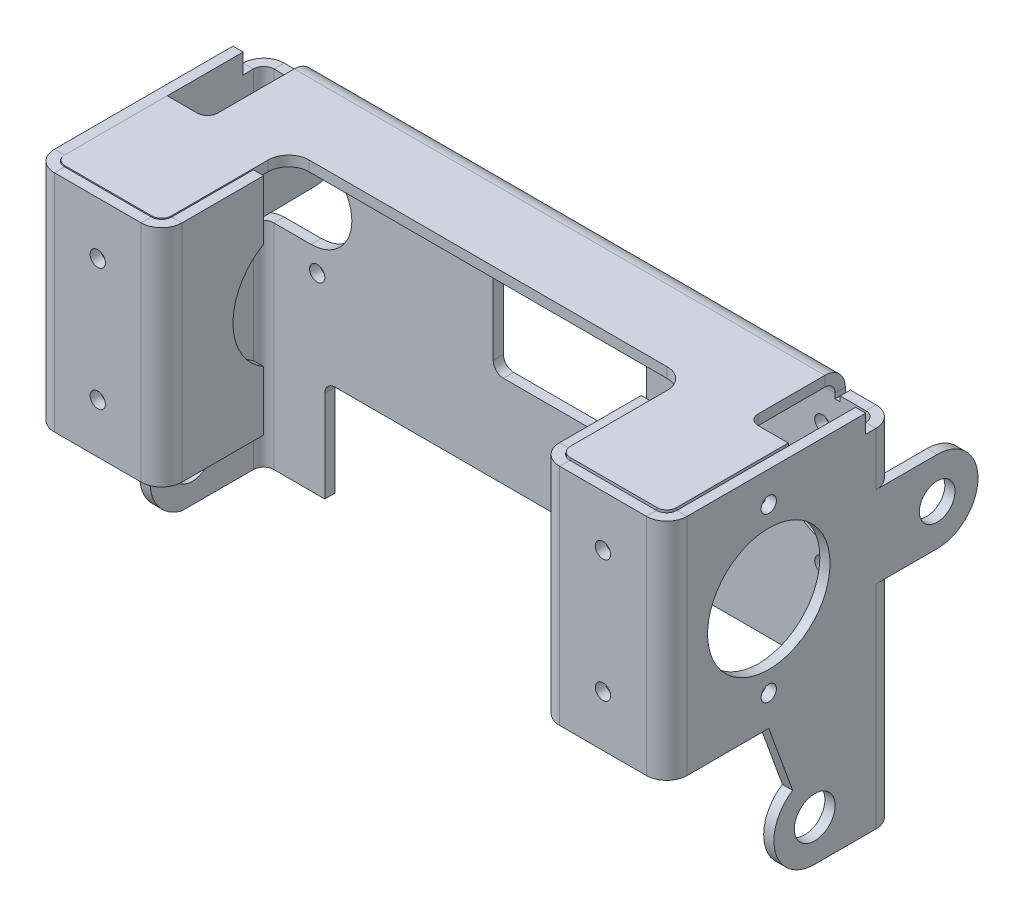
from build123d import *

# Parameters (mm, degrees)
BASE_FLANGE1_DEPTH           = 2
EDGE_FLANGE1_STRIP_W         = 12
EDGE_FLANGE1_STRIP_H         = 2
EDGE_FLANGE1_STRIP_CUT_DEPTH = 68
EDGE_FLANGE1_DEPTH           = 68
EDGE_FLANGE1_PROFILE_R       = 4
EDGE_FLANGE1_FLAT_DEPTH      = 2
EDGE_FLANGE2_STRIP_W         = 12
EDGE_FLANGE2_STRIP_H         = 2
EDGE_FLANGE2_STRIP_CUT_DEPTH = 44
EDGE_FLANGE2_DEPTH           = 44
EDGE_FLANGE3_STRIP_W         = 12
EDGE_FLANGE3_STRIP_H         = 2
EDGE_FLANGE3_STRIP_CUT_DEPTH = 44
EDGE_FLANGE3_DEPTH           = 44
SKETCH24_R                   = 12
SKETCH24_R_2                 = 1.5
CUT_EXTRUDE1_DEPTH           = 10
CUT_EXTRUDE2_START           = -10
SKETCH25_R                   = 12
CUT_EXTRUDE2_DEPTH           = 10
SKETCH26_R                   = 1.5
CUT_EXTRUDE3_DEPTH           = 139.956827828
UNFOLD1_DEPTH                = 71.573994365
UNFOLD1_START                = 27.573994365
UNFOLD1_2_DEPTH              = 4.4999999
UNFOLD1_START_2              = 67.073994465
UNFOLD1_3_DEPTH              = 4.4999999
UNFOLD1_4_DEPTH              = 68
UNFOLD1_START_3              = 35.073994465
UNFOLD1_5_DEPTH              = 0.9999998
UNFOLD1_START_4              = 63.073994465
UNFOLD1_6_DEPTH              = 0.9999998
UNFOLD1_7_DEPTH              = 67.073994465
UNFOLD1_START_5              = -2
UNFOLD1_8_OUTLINE_R          = 12
UNFOLD1_8_OUTLINE_R_2        = 4
UNFOLD1_8_DEPTH              = 25
UNFOLD1_9_DEPTH              = 2
UNFOLD1_START_6              = 149.71238898
UNFOLD1_10_OUTLINE_R         = 1.5
UNFOLD1_10_DEPTH             = 2
CUT_EXTRUDE4_DEPTH           = 170.498227041
CUT_EXTRUDE4_DEPTH_BACK      = 170.498227041
FOLD1_DEPTH                  = 71.573994365
FOLD1_2_DEPTH                = 71.573994365
FOLD1_3_DEPTH                = 41.573994365
FOLD1_START                  = 41.573994365
FOLD1_4_OUTLINE_W            = 2
FOLD1_4_OUTLINE_H            = 2
FOLD1_4_DEPTH                = 26.426005635
FOLD1_START_2                = 57.573994365
FOLD1_5_DEPTH                = 10.426005635
FOLD1_START_3                = 85
FOLD1_6_OUTLINE_R            = 12
FOLD1_6_OUTLINE_R_2          = 4
FOLD1_6_DEPTH                = 25
FOLD1_START_4                = 108
FOLD1_7_DEPTH                = 2
FOLD1_START_5                = 41
FOLD1_8_OUTLINE_R            = 1.5
FOLD1_8_DEPTH                = 2
TAB1_DEPTH                   = 2
CUT_EXTRUDE5_DEPTH           = 150.696359341
CUT_EXTRUDE5_DEPTH_BACK      = 150.696359341
SKETCH35_R                   = 3.5
EDGE_FLANGE4_STRIP_W         = 12
EDGE_FLANGE4_STRIP_H         = 2
EDGE_FLANGE4_STRIP_CUT_DEPTH = 68
EDGE_FLANGE4_DEPTH           = 68
EDGE_FLANGE4_FLAT_DEPTH      = 2
EDGE_FLANGE5_STRIP_W         = 12
EDGE_FLANGE5_STRIP_H         = 2
EDGE_FLANGE5_STRIP_CUT_DEPTH = 71.872497443
EDGE_FLANGE5_DEPTH           = 71.872497443
EDGE_FLANGE6_STRIP_W         = 12
EDGE_FLANGE6_STRIP_H         = 2
EDGE_FLANGE6_STRIP_CUT_DEPTH = 71.872497443
EDGE_FLANGE6_DEPTH           = 71.872497443
CUT_EXTRUDE7_DEPTH           = 150.696359341
CUT_EXTRUDE7_DEPTH_BACK      = 30
SKETCH47_R                   = 4
SKETCH47_R_2                 = 12
SKETCH47_R_3                 = 1.5
SKETCH53_W                   = 4
SKETCH53_H                   = 27.872497443
CUT_EXTRUDE10_DEPTH          = 30
UNFOLD5_DEPTH                = 43
UNFOLD5_START                = -2
UNFOLD5_2_OUTLINE_R          = 4
UNFOLD5_2_OUTLINE_R_2        = 1.5
UNFOLD5_2_DEPTH              = 1.81124
UNFOLD5_START_2              = 19
UNFOLD5_3_DEPTH              = 4
UNFOLD5_START_3              = -1.78876
UNFOLD5_4_DEPTH              = 3.78876
UNFOLD5_START_4              = 1.61096
UNFOLD5_5_OUTLINE_W          = 2
UNFOLD5_5_OUTLINE_H          = 44
UNFOLD5_5_DEPTH              = 18.873595853
UNFOLD5_6_OUTLINE_R          = 4
UNFOLD5_6_OUTLINE_R_2        = 1.5
UNFOLD5_6_DEPTH              = 1.78876
UNFOLD5_7_DEPTH              = 71.872497443
UNFOLD5_START_5              = 68
UNFOLD5_8_OUTLINE_W          = 8
UNFOLD5_8_OUTLINE_H          = 1.81124
UNFOLD5_8_DEPTH              = 3.872497443
UNFOLD5_9_DEPTH              = 27.872497443
CUT_EXTRUDE11_DEPTH          = 30
FOLD4_DEPTH                  = 71.872497443
FOLD4_2_DEPTH                = 71.872497443
FOLD4_3_DEPTH                = 41.872497443
FOLD4_START                  = 41.872497443
FOLD4_4_OUTLINE_W            = 2
FOLD4_4_OUTLINE_H            = 2
FOLD4_4_DEPTH                = 26.127502557
FOLD4_START_2                = 57.872497443
FOLD4_5_DEPTH                = 10.127502557
FOLD4_START_3                = -14
FOLD4_6_OUTLINE_R            = 4
FOLD4_6_OUTLINE_R_2          = 1.5
FOLD4_6_DEPTH                = 25
TAB5_START                   = -2
SKETCH66_R                   = 3.5
TAB5_DEPTH                   = 2
EDGE_FLANGE7_START           = -4
EDGE_FLANGE7_DEPTH           = 104
EDGE_FLANGE7_START_2         = 89
EDGE_FLANGE7_2_OUTLINE_W     = 2
EDGE_FLANGE7_2_OUTLINE_H     = 23.823099538
EDGE_FLANGE7_2_DEPTH         = 17
EDGE_FLANGE7_START_3         = -10
EDGE_FLANGE7_3_OUTLINE_W     = 2
EDGE_FLANGE7_3_OUTLINE_H     = 21.9
EDGE_FLANGE7_3_DEPTH         = 17
EDGE_FLANGE7_4_OUTLINE_W     = 2
EDGE_FLANGE7_4_OUTLINE_H     = 3
EDGE_FLANGE7_4_DEPTH         = 12.9
EDGE_FLANGE7_START_4         = 87.1
EDGE_FLANGE7_5_OUTLINE_W     = 2
EDGE_FLANGE7_5_OUTLINE_H     = 3
EDGE_FLANGE7_5_DEPTH         = 12.9
EDGE_FLANGE7_START_5         = 102
EDGE_FLANGE7_6_OUTLINE_W     = 2
EDGE_FLANGE7_6_OUTLINE_H     = 1.923099538
EDGE_FLANGE7_6_DEPTH         = 5.9
EDGE_FLANGE7_START_6         = 70
EDGE_FLANGE7_7_DEPTH         = 2
EDGE_FLANGE7_8_DEPTH         = 104
EDGE_FLANGE7_START_7         = -5
EDGE_FLANGE7_9_OUTLINE_W     = 1
EDGE_FLANGE7_9_OUTLINE_H     = 2
EDGE_FLANGE7_9_DEPTH         = 1
EDGE_FLANGE7_START_8         = 100
EDGE_FLANGE7_10_OUTLINE_W    = 1
EDGE_FLANGE7_10_OUTLINE_H    = 2
EDGE_FLANGE7_10_DEPTH        = 1
EDGE_FLANGE7_START_9         = 71.57752
EDGE_FLANGE7_11_OUTLINE_W    = 104
EDGE_FLANGE7_11_OUTLINE_H    = 2
EDGE_FLANGE7_11_DEPTH        = 1.42248


with BuildPart() as part:
    # Base-Flange1: sheet metal written as solids
    # Sketch6 → Base-Flange1 (new body)
    with BuildSketch(Plane.XY):
        with BuildLine():
            Line((0, 0), (0, 18))
            ThreePointArc((0, 18), (0.585786438, 19.414213562), (2, 20))
            Line((2, 20), (94, 20))
            ThreePointArc((94, 20), (95.414213562, 19.414213562), (96, 18))
            Line((96, 18), (96, 0))
            Line((96, 0), (110, 0))
            Line((110, 0), (110, 68))
            Line((110, 68), (100, 68))
            Line((100, 68), (100, 72))
            Line((100, 72), (-4, 72))
            Line((-4, 72), (-4, 68))
            Line((-4, 68), (-14, 68))
            Line((-14, 68), (-14, 0))
            Line((-14, 0), (0, 0))
        make_face()
        with BuildLine():
            Line((35, 62), (61, 62))
            ThreePointArc((61, 62), (62.414213562, 61.414213562), (63, 60))
            Line((63, 60), (63, 40))
            ThreePointArc((63, 40), (62.414213562, 38.585786438), (61, 38))
            Line((61, 38), (35, 38))
            ThreePointArc((35, 38), (33.585786438, 38.585786438), (33, 40))
            Line((33, 40), (33, 60))
            ThreePointArc((33, 60), (33.585786438, 61.414213562), (35, 62))
        make_face(mode=Mode.SUBTRACT)
    extrude(amount=-BASE_FLANGE1_DEPTH)

    # Edge-Flange1: sheet metal written as solids
    # Edge-Flange1 strip (on a plane across the edge) → Edge-Flange1 strip cut (cut)
    with BuildSketch(Plane(origin=(110, 0, 0), x_dir=(-1, 0, 0), z_dir=(0, 1, 0))):
        with Locations((-2, -1)):
            Rectangle(EDGE_FLANGE1_STRIP_W, EDGE_FLANGE1_STRIP_H)
    extrude(amount=EDGE_FLANGE1_STRIP_CUT_DEPTH, mode=Mode.SUBTRACT)

    # Edge-Flange1 bend section (on a plane across the edge) → Edge-Flange1 (add)
    with BuildSketch(Plane(origin=(110, 0, 0), x_dir=(-1, 0, 0), z_dir=(0, 1, 0))):
        with BuildLine():
            Line((0, 2), (2, 2))
            ThreePointArc((2, 2), (2.585786438, 0.585786438), (4, 0))
            Line((4, 0), (4, -2))
            ThreePointArc((4, -2), (1.171572875, -0.828427125), (0, 2))
        make_face()
    extrude(amount=EDGE_FLANGE1_DEPTH)

    # Edge-Flange1 profile (on flange) → Edge-Flange1 flat (add)
    with BuildSketch(Plane(origin=(110, 0, 0), x_dir=(0, -1, 0), z_dir=(-1, 0, 0))):
        with BuildLine():
            ThreePointArc((0, 14), (-5.746115462, 21.675936717), (-14.730001122, 18.325168771))
            Line((-14.730001122, 18.325168771), (-27.573994365, 23))
            Line((-27.573994365, 23), (-27.573994365, 43))
            Line((-27.573994365, 43), (-71.573994365, 43))
            Line((-71.573994365, 43), (-71.573994365, 4))
            Line((-71.573994365, 4), (-68, 4))
            Line((-68, 4), (-68, 2))
            Line((-68, 2), (0, 2))
            Line((0, 2), (0, 14))
        make_face()
        with Locations((-8, 14)):
            Circle(EDGE_FLANGE1_PROFILE_R, mode=Mode.SUBTRACT)
    extrude(amount=EDGE_FLANGE1_FLAT_DEPTH)

    # Edge-Flange2: sheet metal written as solids
    # Edge-Flange2 strip (on a plane across the edge) → Edge-Flange2 strip cut (cut)
    with BuildSketch(Plane(origin=(108, 27.573994365, 43), x_dir=(0, 0, -1), z_dir=(0, 1, 0))):
        with Locations((-2, -1)):
            Rectangle(EDGE_FLANGE2_STRIP_W, EDGE_FLANGE2_STRIP_H)
    extrude(amount=EDGE_FLANGE2_STRIP_CUT_DEPTH, mode=Mode.SUBTRACT)

    # Edge-Flange2 section (on a plane across the edge) → Edge-Flange2 (add)
    with BuildSketch(Plane(origin=(108, 27.573994365, 43), x_dir=(0, 0, -1), z_dir=(0, 1, 0))):
        with BuildLine():
            Line((0, 2), (0, 23))
            Line((0, 23), (2, 23))
            Line((2, 23), (2, 2))
            ThreePointArc((2, 2), (2.585786438, 0.585786438), (4, 0))
            Line((4, 0), (4, -2))
            ThreePointArc((4, -2), (1.171572875, -0.828427125), (0, 2))
        make_face()
    extrude(amount=EDGE_FLANGE2_DEPTH)

    # Edge-Flange3: sheet metal written as solids
    # Edge-Flange3 strip (on a plane across the edge) → Edge-Flange3 strip cut (cut)
    with BuildSketch(Plane(origin=(85, 27.573994365, 41), x_dir=(1, 0, 0), z_dir=(0, 1, 0))):
        with Locations((-2, -1)):
            Rectangle(EDGE_FLANGE3_STRIP_W, EDGE_FLANGE3_STRIP_H)
    extrude(amount=EDGE_FLANGE3_STRIP_CUT_DEPTH, mode=Mode.SUBTRACT)

    # Edge-Flange3 section (on a plane across the edge) → Edge-Flange3 (add)
    with BuildSketch(Plane(origin=(85, 27.573994365, 41), x_dir=(1, 0, 0), z_dir=(0, 1, 0))):
        with BuildLine():
            Line((0, 2), (0, 18))
            Line((0, 18), (2, 18))
            Line((2, 18), (2, 2))
            ThreePointArc((2, 2), (2.585786438, 0.585786438), (4, 0))
            Line((4, 0), (4, -2))
            ThreePointArc((4, -2), (1.171572875, -0.828427125), (0, 2))
        make_face()
    extrude(amount=EDGE_FLANGE3_DEPTH)

    # Sketch24 → Cut-Extrude1 (cut)
    with BuildSketch(Plane(origin=(110, 0, 0), x_dir=(0, 0, -1), z_dir=(1, 0, 0))):
        with Locations((-23, 49.573994365)):
            Circle(SKETCH24_R)
        with Locations((-23, 65.573994365)):
            Circle(SKETCH24_R_2)
        with Locations(Location((-23, 33.573994365, 0), (0, 0, 180))):
            Circle(SKETCH24_R_2)
    extrude(amount=-CUT_EXTRUDE1_DEPTH, mode=Mode.SUBTRACT)

    # Sketch25 → Cut-Extrude2 (cut)
    with BuildSketch(Plane.ZY.offset(-85).offset(CUT_EXTRUDE2_START)):
        with Locations(Location((23, 49.573994365, 0), (0, 0, 180))):
            Circle(SKETCH25_R)
    extrude(amount=CUT_EXTRUDE2_DEPTH, mode=Mode.SUBTRACT)

    # Sketch26 → Cut-Extrude3 (cut, symmetric)
    with BuildSketch(Plane.XY.offset(43)):
        with Locations((97.5, 61.573994365)):
            Circle(SKETCH26_R)
        with Locations(Location((97.5, 37.573994365, 0), (0, 0, 180))):
            Circle(SKETCH26_R)
    cut_extrude3 = extrude(amount=CUT_EXTRUDE3_DEPTH, both=True, mode=Mode.SUBTRACT)

    # Unfold1: read off the stored shape, not the designer's step
    # Unfold1 outline → Unfold1 (cut)
    with BuildSketch(Plane(origin=(0, 0, 0), x_dir=(1, 0, 0), z_dir=(0, 1, 0))):
        with BuildLine():
            ThreePointArc((110, -2), (109.863703305, -0.96472382), (109.464101616, 0))
            Line((109.464101616, 0), (106, 0))
            ThreePointArc((106, 0), (107.414213562, -0.585786438), (108, -2))
            Line((108, -2), (108, -39))
            ThreePointArc((108, -39), (107.414213562, -40.414213562), (106, -41))
            Line((106, -41), (89, -41))
            ThreePointArc((89, -41), (87.585786438, -40.414213562), (87, -39))
            Line((87, -39), (87, -23))
            Line((87, -23), (85, -23))
            Line((85, -23), (85, -39))
            ThreePointArc((85, -39), (86.171572875, -41.828427125), (89, -43))
            Line((89, -43), (106, -43))
            ThreePointArc((106, -43), (108.828427125, -41.828427125), (110, -39))
            Line((110, -39), (110, -2))
        make_face()
    extrude(amount=UNFOLD1_DEPTH, mode=Mode.SUBTRACT)

    # Unfold1 2 outline → Unfold1 2 (add)
    with BuildSketch(Plane(origin=(0, 0, 0), x_dir=(1, 0, 0), z_dir=(0, 1, 0)).offset(UNFOLD1_START)):
        with BuildLine():
            Line((147.71238898, -21), (131.71238898, -21))
            Line((131.71238898, -21), (131.71238898, -23))
            Line((131.71238898, -23), (147.71238898, -23))
            ThreePointArc((147.71238898, -23), (150.540816105, -21.828427125), (151.71238898, -19))
            Line((151.71238898, -19), (151.71238898, -2))
            ThreePointArc((151.71238898, -2), (150.540816105, 0.828427125), (147.71238898, 2))
            Line((147.71238898, 2), (106, 2))
            ThreePointArc((106, 2), (108, 1.464101615), (109.464101616, 0))
            Line((109.464101616, 0), (147.71238898, 0))
            ThreePointArc((147.71238898, 0), (149.126602542, -0.585786437), (149.71238898, -2))
            Line((149.71238898, -2), (149.71238898, -19))
            ThreePointArc((149.71238898, -19), (149.126602542, -20.414213563), (147.71238898, -21))
        make_face()
    extrude(amount=UNFOLD1_2_DEPTH)



with BuildPart() as body_2:
    # Unfold1 3 outline → Unfold1 3 (new body)
    with BuildSketch(Plane(origin=(0, 0, 0), x_dir=(1, 0, 0), z_dir=(0, 1, 0)).offset(UNFOLD1_START_2)):
        with BuildLine():
            Line((147.71238898, -21), (131.71238898, -21))
            Line((131.71238898, -21), (131.71238898, -23))
            Line((131.71238898, -23), (147.71238898, -23))
            ThreePointArc((147.71238898, -23), (150.540816105, -21.828427125), (151.71238898, -19))
            Line((151.71238898, -19), (151.71238898, -2))
            ThreePointArc((151.71238898, -2), (150.540816105, 0.828427125), (147.71238898, 2))
            Line((147.71238898, 2), (112.71238898, 2))
            Line((112.71238898, 2), (112.71238898, 0))
            Line((112.71238898, 0), (147.71238898, 0))
            ThreePointArc((147.71238898, 0), (149.126602542, -0.585786437), (149.71238898, -2))
            Line((149.71238898, -2), (149.71238898, -19))
            ThreePointArc((149.71238898, -19), (149.126602542, -20.414213563), (147.71238898, -21))
        make_face()
    extrude(amount=UNFOLD1_3_DEPTH)


with BuildPart() as part_1:
    add(part.part)

    add(body_2.part)  # Unfold1 4 merges body 2
    # Unfold1 4 outline → Unfold1 4 (add)
    with BuildSketch(Plane(origin=(0, 0, 0), x_dir=(1, 0, 0), z_dir=(0, 1, 0))):
        with BuildLine():
            Line((109.464101616, 0), (112.71238898, 0))
            Line((112.71238898, 0), (112.71238898, 2))
            Line((112.71238898, 2), (106, 2))
            ThreePointArc((106, 2), (108, 1.464101615), (109.464101616, 0))
        make_face()
    extrude(amount=UNFOLD1_4_DEPTH)

    # Unfold1 5 outline → Unfold1 5 (add)
    with BuildSketch(Plane(origin=(0, 0, 0), x_dir=(1, 0, 0), z_dir=(0, 1, 0)).offset(UNFOLD1_START_3)):
        with BuildLine():
            Line((147.71238898, -21), (131.71238898, -21))
            Line((131.71238898, -21), (131.71238898, -23))
            Line((131.71238898, -23), (147.71238898, -23))
            ThreePointArc((147.71238898, -23), (150.540816105, -21.828427125), (151.71238898, -19))
            Line((151.71238898, -19), (151.71238898, -2))
            ThreePointArc((151.71238898, -2), (150.540816105, 0.828427125), (147.71238898, 2))
            Line((147.71238898, 2), (112.71238898, 2))
            Line((112.71238898, 2), (112.71238898, 0))
            Line((112.71238898, 0), (147.71238898, 0))
            ThreePointArc((147.71238898, 0), (149.126602542, -0.585786437), (149.71238898, -2))
            Line((149.71238898, -2), (149.71238898, -19))
            ThreePointArc((149.71238898, -19), (149.126602542, -20.414213563), (147.71238898, -21))
        make_face()
    extrude(amount=UNFOLD1_5_DEPTH)

    # Unfold1 6 outline → Unfold1 6 (add)
    with BuildSketch(Plane(origin=(0, 0, 0), x_dir=(1, 0, 0), z_dir=(0, 1, 0)).offset(UNFOLD1_START_4)):
        with BuildLine():
            Line((147.71238898, -21), (131.71238898, -21))
            Line((131.71238898, -21), (131.71238898, -23))
            Line((131.71238898, -23), (147.71238898, -23))
            ThreePointArc((147.71238898, -23), (150.540816105, -21.828427125), (151.71238898, -19))
            Line((151.71238898, -19), (151.71238898, -2))
            ThreePointArc((151.71238898, -2), (150.540816105, 0.828427125), (147.71238898, 2))
            Line((147.71238898, 2), (112.71238898, 2))
            Line((112.71238898, 2), (112.71238898, 0))
            Line((112.71238898, 0), (147.71238898, 0))
            ThreePointArc((147.71238898, 0), (149.126602542, -0.585786437), (149.71238898, -2))
            Line((149.71238898, -2), (149.71238898, -19))
            ThreePointArc((149.71238898, -19), (149.126602542, -20.414213563), (147.71238898, -21))
        make_face()
    extrude(amount=UNFOLD1_6_DEPTH)

    # Unfold1 7 outline → Unfold1 7 (add)
    with BuildSketch(Plane(origin=(0, 0, 0), x_dir=(1, 0, 0), z_dir=(0, 1, 0))):
        with BuildLine():
            Line((147.71238898, -21), (131.71238898, -21))
            Line((131.71238898, -21), (131.71238898, -23))
            Line((131.71238898, -23), (147.71238898, -23))
            ThreePointArc((147.71238898, -23), (150.540816105, -21.828427125), (151.71238898, -19))
            Line((151.71238898, -19), (151.71238898, -2))
            ThreePointArc((151.71238898, -2), (150.540816105, 0.828427125), (147.71238898, 2))
            Line((147.71238898, 2), (112.71238898, 2))
            Line((112.71238898, 2), (112.71238898, 0))
            Line((112.71238898, 0), (147.71238898, 0))
            ThreePointArc((147.71238898, 0), (149.126602542, -0.585786437), (149.71238898, -2))
            Line((149.71238898, -2), (149.71238898, -19))
            ThreePointArc((149.71238898, -19), (149.126602542, -20.414213563), (147.71238898, -21))
        make_face()
    extrude(amount=UNFOLD1_7_DEPTH)

    # Unfold1 8 outline → Unfold1 8 (cut)
    with BuildSketch(Plane.XY.offset(UNFOLD1_START_5)):
        with BuildLine():
            Line((151.71238898, 0), (151.71238898, 27.573994365))
            Line((151.71238898, 27.573994365), (131.71238898, 27.573994365))
            Line((131.71238898, 27.573994365), (127.037557751, 14.730001122))
            ThreePointArc((127.037557751, 14.730001122), (130.388325698, 5.746115462), (122.71238898, 0))
            Line((122.71238898, 0), (151.71238898, 0))
        make_face()
        with BuildLine():
            ThreePointArc((131.71238898, 67.073994365), (130.21238898, 65.573994365), (131.71238898, 64.073994365))
            Line((131.71238898, 64.073994365), (131.71238898, 67.073994365))
        make_face()
        with Locations((131.71238898, 49.573994365)):
            Circle(UNFOLD1_8_OUTLINE_R)
        with BuildLine():
            ThreePointArc((131.71238898, 35.073994365), (130.21238898, 33.573994365), (131.71238898, 32.073994365))
            Line((131.71238898, 32.073994365), (131.71238898, 35.073994365))
        make_face()
        with Locations((122.71238898, 8)):
            Circle(UNFOLD1_8_OUTLINE_R_2)
    extrude(amount=UNFOLD1_8_DEPTH, mode=Mode.SUBTRACT)

    # Unfold1 9 outline → Unfold1 9 (cut)
    with BuildSketch(Plane.XY.offset(UNFOLD1_START_5)):
        with BuildLine():
            Line((131.71238898, 67.073994365), (131.71238898, 64.073994365))
            ThreePointArc((131.71238898, 64.073994365), (133.21238898, 65.573994365), (131.71238898, 67.073994365))
        make_face()
        with BuildLine():
            Line((131.71238898, 35.073994365), (131.71238898, 32.073994365))
            ThreePointArc((131.71238898, 32.073994365), (133.21238898, 33.573994365), (131.71238898, 35.073994365))
        make_face()
    extrude(amount=UNFOLD1_9_DEPTH, mode=Mode.SUBTRACT)

    # Unfold1 10 outline → Unfold1 10 (cut)
    with BuildSketch(Plane.YZ.offset(UNFOLD1_START_6)):
        with Locations((37.573994365, 10.5)):
            Circle(UNFOLD1_10_OUTLINE_R)
        with Locations((61.573994365, 10.5)):
            Circle(UNFOLD1_10_OUTLINE_R)
    extrude(amount=UNFOLD1_10_DEPTH, mode=Mode.SUBTRACT)

    # Sketch30 → Cut-Extrude4 (cut, two sides: drawn at the far end of the back side and taken through both)
    with BuildSketch(Plane.XY.offset(-CUT_EXTRUDE4_DEPTH_BACK)):
        with BuildLine():
            Line((98.71238898, 57.573994365), (110.71238898, 57.573994365))
            Line((110.71238898, 57.573994365), (110.71238898, 41.573994365))
            Line((110.71238898, 41.573994365), (98.71238898, 41.573994365))
            ThreePointArc((98.71238898, 41.573994365), (90.71238898, 49.573994365), (98.71238898, 57.573994365))
        make_face()
    extrude(amount=CUT_EXTRUDE4_DEPTH + CUT_EXTRUDE4_DEPTH_BACK, mode=Mode.SUBTRACT)

    # Fold1: read off the stored shape, not the designer's step
    # Fold1 outline → Fold1 (cut)
    with BuildSketch(Plane(origin=(0, 0, 0), x_dir=(1, 0, 0), z_dir=(0, 1, 0))):
        with BuildLine():
            ThreePointArc((106, 2), (108, 1.464101615), (109.464101616, 0))
            Line((109.464101616, 0), (147.71238898, 0))
            ThreePointArc((147.71238898, 0), (149.126602542, -0.585786437), (149.71238898, -2))
            Line((149.71238898, -2), (149.71238898, -19))
            ThreePointArc((149.71238898, -19), (149.126602542, -20.414213563), (147.71238898, -21))
            Line((147.71238898, -21), (131.71238898, -21))
            Line((131.71238898, -21), (131.71238898, -23))
            Line((131.71238898, -23), (147.71238898, -23))
            ThreePointArc((147.71238898, -23), (150.540816105, -21.828427125), (151.71238898, -19))
            Line((151.71238898, -19), (151.71238898, -2))
            ThreePointArc((151.71238898, -2), (150.540816105, 0.828427125), (147.71238898, 2))
            Line((147.71238898, 2), (106, 2))
        make_face()
    extrude(amount=FOLD1_DEPTH, mode=Mode.SUBTRACT)



with BuildPart() as body_2_2:
    # Fold1 2 outline → Fold1 2 (new body)
    with BuildSketch(Plane(origin=(0, 0, 0), x_dir=(1, 0, 0), z_dir=(0, 1, 0))):
        with BuildLine():
            Line((87, -39), (87, -23))
            Line((87, -23), (85, -23))
            Line((85, -23), (85, -39))
            ThreePointArc((85, -39), (86.171572875, -41.828427125), (89, -43))
            Line((89, -43), (106, -43))
            ThreePointArc((106, -43), (108.828427125, -41.828427125), (110, -39))
            Line((110, -39), (110, -4))
            Line((110, -4), (108, -4))
            Line((108, -4), (108, -39))
            ThreePointArc((108, -39), (107.414213562, -40.414213562), (106, -41))
            Line((106, -41), (89, -41))
            ThreePointArc((89, -41), (87.585786438, -40.414213562), (87, -39))
        make_face()
    extrude(amount=FOLD1_2_DEPTH)


with BuildPart() as part_2:
    add(part_1.part)

    add(body_2_2.part)  # Fold1 3 merges body 2 2
    # Fold1 3 outline → Fold1 3 (add)
    with BuildSketch(Plane(origin=(0, 0, 0), x_dir=(1, 0, 0), z_dir=(0, 1, 0))):
        with BuildLine():
            Line((108, -2), (108, -4))
            Line((108, -4), (110, -4))
            Line((110, -4), (110, -2))
            ThreePointArc((110, -2), (109.863703305, -0.96472382), (109.464101616, 0))
            Line((109.464101616, 0), (106, 0))
            ThreePointArc((106, 0), (107.414213562, -0.585786438), (108, -2))
        make_face()
    extrude(amount=FOLD1_3_DEPTH)

    # Fold1 4 outline → Fold1 4 (add)
    with BuildSketch(Plane(origin=(0, 0, 0), x_dir=(1, 0, 0), z_dir=(0, 1, 0)).offset(FOLD1_START)):
        with Locations((109, -3)):
            Rectangle(FOLD1_4_OUTLINE_W, FOLD1_4_OUTLINE_H)
    extrude(amount=FOLD1_4_DEPTH)

    # Fold1 5 outline → Fold1 5 (add)
    with BuildSketch(Plane(origin=(0, 0, 0), x_dir=(1, 0, 0), z_dir=(0, 1, 0)).offset(FOLD1_START_2)):
        with BuildLine():
            ThreePointArc((106, 0), (107.414213562, -0.585786438), (108, -2))
            Line((108, -2), (110, -2))
            ThreePointArc((110, -2), (109.863703305, -0.96472382), (109.464101616, 0))
            Line((109.464101616, 0), (106, 0))
        make_face()
    extrude(amount=FOLD1_5_DEPTH)

    # Fold1 6 outline → Fold1 6 (cut)
    with BuildSketch(Plane.YZ.offset(FOLD1_START_3)):
        with BuildLine():
            Line((0, 43), (0, 14))
            ThreePointArc((0, 14), (5.746115462, 21.675936717), (14.730001122, 18.325168771))
            Line((14.730001122, 18.325168771), (27.573994365, 23))
            Line((27.573994365, 23), (27.573994365, 43))
            Line((27.573994365, 43), (0, 43))
        make_face()
        with BuildLine():
            Line((67.073994365, 23), (64.073994365, 23))
            ThreePointArc((64.073994365, 23), (65.573994365, 21.5), (67.073994365, 23))
        make_face()
        with Locations((49.573994365, 23)):
            Circle(FOLD1_6_OUTLINE_R)
        with BuildLine():
            Line((35.073994365, 23), (32.073994365, 23))
            ThreePointArc((32.073994365, 23), (33.573994365, 21.5), (35.073994365, 23))
        make_face()
        with Locations((8, 14)):
            Circle(FOLD1_6_OUTLINE_R_2)
    extrude(amount=FOLD1_6_DEPTH, mode=Mode.SUBTRACT)

    # Fold1 7 outline → Fold1 7 (cut)
    with BuildSketch(Plane.YZ.offset(FOLD1_START_4)):
        with BuildLine():
            ThreePointArc((67.073994365, 23), (65.573994365, 24.5), (64.073994365, 23))
            Line((64.073994365, 23), (67.073994365, 23))
        make_face()
        with BuildLine():
            ThreePointArc((35.073994365, 23), (33.573994365, 24.5), (32.073994365, 23))
            Line((32.073994365, 23), (35.073994365, 23))
        make_face()
    extrude(amount=FOLD1_7_DEPTH, mode=Mode.SUBTRACT)

    # Fold1 8 outline → Fold1 8 (cut)
    with BuildSketch(Plane.XY.offset(FOLD1_START_5)):
        with Locations((97.5, 37.573994365)):
            Circle(FOLD1_8_OUTLINE_R)
        with Locations((97.5, 61.573994365)):
            Circle(FOLD1_8_OUTLINE_R)
    extrude(amount=FOLD1_8_DEPTH, mode=Mode.SUBTRACT)

    # Tab1: sheet metal written as solids
    # Sketch34 → Tab1 (add)
    with BuildSketch(Plane(origin=(110, 0, 0), x_dir=(0, 0, -1), z_dir=(1, 0, 0))):
        with BuildLine():
            Line((-2, 57.573994365), (10, 57.573994365))
            ThreePointArc((10, 57.573994365), (18, 49.573994365), (10, 41.573994365))
            Line((10, 41.573994365), (-2, 41.573994365))
            Line((-2, 41.573994365), (-2, 57.573994365))
        make_face()
    extrude(amount=-TAB1_DEPTH)

    # Sketch35 → Cut-Extrude5 (cut, two sides: drawn at the far end of the back side and taken through both)
    with BuildSketch(Plane(origin=(110, 0, 0), x_dir=(0, 0, -1), z_dir=(1, 0, 0)).offset(-CUT_EXTRUDE5_DEPTH_BACK)):
        with Locations(Location((10, 49.573994365, 0), (0, 0, 270))):
            Circle(SKETCH35_R)
    extrude(amount=CUT_EXTRUDE5_DEPTH + CUT_EXTRUDE5_DEPTH_BACK, mode=Mode.SUBTRACT)

    # Edge-Flange4: sheet metal written as solids
    # Edge-Flange4 strip (on a plane across the edge) → Edge-Flange4 strip cut (cut)
    with BuildSketch(Plane(origin=(-14, 68, 0), x_dir=(1, 0, 0), z_dir=(0, -1, 0))):
        with Locations((-2, -1)):
            Rectangle(EDGE_FLANGE4_STRIP_W, EDGE_FLANGE4_STRIP_H)
    extrude(amount=EDGE_FLANGE4_STRIP_CUT_DEPTH, mode=Mode.SUBTRACT)

    # Edge-Flange4 bend section (on a plane across the edge) → Edge-Flange4 (add)
    with BuildSketch(Plane(origin=(-14, 68, 0), x_dir=(1, 0, 0), z_dir=(0, -1, 0))):
        with BuildLine():
            Line((0, 2), (2, 2))
            ThreePointArc((2, 2), (2.585786438, 0.585786438), (4, 0))
            Line((4, 0), (4, -2))
            ThreePointArc((4, -2), (1.171572875, -0.828427125), (0, 2))
        make_face()
    extrude(amount=EDGE_FLANGE4_DEPTH)

    # Edge-Flange4 profile (on flange) → Edge-Flange4 flat (add)
    with BuildSketch(Plane.YZ.offset(-14)):
        Polygon((68, 2), (68, 4), (71.872497443, 4), (71.872497443, 43), (0, 43), (0, 2), align=None)
    extrude(amount=EDGE_FLANGE4_FLAT_DEPTH)

    # Edge-Flange5: sheet metal written as solids
    # Edge-Flange5 strip (on a plane across the edge) → Edge-Flange5 strip cut (cut)
    with BuildSketch(Plane(origin=(-12, 71.872497443, 43), x_dir=(0, 0, -1), z_dir=(0, -1, 0))):
        with Locations((-2, -1)):
            Rectangle(EDGE_FLANGE5_STRIP_W, EDGE_FLANGE5_STRIP_H)
    extrude(amount=EDGE_FLANGE5_STRIP_CUT_DEPTH, mode=Mode.SUBTRACT)

    # Edge-Flange5 section (on a plane across the edge) → Edge-Flange5 (add)
    with BuildSketch(Plane(origin=(-12, 71.872497443, 43), x_dir=(0, 0, -1), z_dir=(0, -1, 0))):
        with BuildLine():
            Line((0, 2), (0, 23))
            Line((0, 23), (2, 23))
            Line((2, 23), (2, 2))
            ThreePointArc((2, 2), (2.585786438, 0.585786438), (4, 0))
            Line((4, 0), (4, -2))
            ThreePointArc((4, -2), (1.171572875, -0.828427125), (0, 2))
        make_face()
    extrude(amount=EDGE_FLANGE5_DEPTH)

    # Edge-Flange6: sheet metal written as solids
    # Edge-Flange6 strip (on a plane across the edge) → Edge-Flange6 strip cut (cut)
    with BuildSketch(Plane(origin=(11, 71.872497443, 41), x_dir=(-1, 0, 0), z_dir=(0, -1, 0))):
        with Locations((-2, -1)):
            Rectangle(EDGE_FLANGE6_STRIP_W, EDGE_FLANGE6_STRIP_H)
    extrude(amount=EDGE_FLANGE6_STRIP_CUT_DEPTH, mode=Mode.SUBTRACT)

    # Edge-Flange6 section (on a plane across the edge) → Edge-Flange6 (add)
    with BuildSketch(Plane(origin=(11, 71.872497443, 41), x_dir=(-1, 0, 0), z_dir=(0, -1, 0))):
        with BuildLine():
            Line((0, 2), (0, 18))
            Line((0, 18), (2, 18))
            Line((2, 18), (2, 2))
            ThreePointArc((2, 2), (2.585786438, 0.585786438), (4, 0))
            Line((4, 0), (4, -2))
            ThreePointArc((4, -2), (1.171572875, -0.828427125), (0, 2))
        make_face()
    extrude(amount=EDGE_FLANGE6_DEPTH)

    # Sketch47 → Cut-Extrude7 (cut, two sides: drawn at the far end of the back side and taken through both)
    with BuildSketch(Plane.ZY.offset(14).offset(-CUT_EXTRUDE7_DEPTH_BACK)):
        with BuildLine():
            Line((39, 0), (39, 27.872497443))
            Line((39, 27.872497443), (19, 27.872497443))
            Line((19, 27.872497443), (14.763349776, 16.232396617))
            ThreePointArc((14.763349776, 16.232396617), (22.240365502, 8.67188789), (16.086877318, 0))
            Line((16.086877318, 0), (39, 0))
        make_face()
        with Locations((14, 8)):
            Circle(SKETCH47_R)
        with Locations((17, 49.872497443)):
            Circle(SKETCH47_R_2)
        with Locations((18.984555753, 65.74894347)):
            Circle(SKETCH47_R_3)
        with Locations((18.984555753, 33.996051415)):
            Circle(SKETCH47_R_3)
    extrude(amount=CUT_EXTRUDE7_DEPTH + CUT_EXTRUDE7_DEPTH_BACK, mode=Mode.SUBTRACT)

    # Sketch53 → Cut-Extrude10 (cut)
    with BuildSketch(Plane.ZY.offset(14)):
        with Locations((41, 13.936248722)):
            Rectangle(SKETCH53_W, SKETCH53_H)
    extrude(amount=-CUT_EXTRUDE10_DEPTH, mode=Mode.SUBTRACT)

    # Unfold5: read off the stored shape, not the designer's step
    # Unfold5 outline → Unfold5 (cut)
    with BuildSketch(Plane.XY):
        Polygon((-14, 0), (-12, 0), (-12, 27.872497443), (11, 27.872497443), (11, 71.872497443), (-14, 71.872497443), align=None)
    extrude(amount=UNFOLD5_DEPTH, mode=Mode.SUBTRACT)

    # Unfold5 2 outline → Unfold5 2 (add)
    with BuildSketch(Plane.XY.offset(UNFOLD5_START)):
        with BuildLine():
            Line((-28.799266299, 0), (-12, 0))
            Line((-12, 0), (-12, 27.872497443))
            Line((-12, 27.872497443), (9, 27.872497443))
            Line((9, 27.872497443), (9, 71.872497443))
            Line((9, 71.872497443), (-12, 71.872497443))
            Line((-12, 71.872497443), (-12, 68))
            Line((-12, 68), (-16.71238898, 68))
            Line((-16.71238898, 68), (-16.71238898, 71.872497443))
            Line((-16.71238898, 71.872497443), (-53.71238898, 71.872497443))
            Line((-53.71238898, 71.872497443), (-53.71238898, 27.872497443))
            Line((-53.71238898, 27.872497443), (-31.71238898, 27.872497443))
            Line((-31.71238898, 27.872497443), (-27.475738756, 16.232396617))
            ThreePointArc((-27.475738756, 16.232396617), (-34.952754482, 8.671887889), (-28.799266299, 0))
        make_face()
        with BuildLine():
            ThreePointArc((-35.71238898, 39.480192598), (-41.71238898, 49.872497443), (-35.71238898, 60.264802288))
            ThreePointArc((-35.71238898, 60.264802288), (-17.71238898, 49.872497443), (-35.71238898, 39.480192598))
        make_face(mode=Mode.SUBTRACT)
        with Locations((-26.71238898, 8)):
            Circle(UNFOLD5_2_OUTLINE_R, mode=Mode.SUBTRACT)
        with Locations((-31.696944734, 33.996051415)):
            Circle(UNFOLD5_2_OUTLINE_R_2, mode=Mode.SUBTRACT)
        with Locations((-31.696944734, 65.74894347)):
            Circle(UNFOLD5_2_OUTLINE_R_2, mode=Mode.SUBTRACT)
    extrude(amount=UNFOLD5_2_DEPTH)

    # Unfold5 4 outline → Unfold5 4 (add)
    with BuildSketch(Plane.XY.offset(UNFOLD5_START_3)):
        with BuildLine():
            Line((-35.71238898, 27.872497443), (-35.71238898, 39.480192598))
            ThreePointArc((-35.71238898, 39.480192598), (-41.71238898, 49.872497443), (-35.71238898, 60.264802288))
            Line((-35.71238898, 60.264802288), (-35.71238898, 71.872497443))
            Line((-35.71238898, 71.872497443), (-55.71238898, 71.872497443))
            Line((-55.71238898, 71.872497443), (-55.71238898, 27.872497443))
            Line((-55.71238898, 27.872497443), (-35.71238898, 27.872497443))
        make_face()
    extrude(amount=UNFOLD5_4_DEPTH)



with BuildPart() as body_2_3:
    # Unfold5 3 outline → Unfold5 3 (new body)
    with BuildSketch(Plane.XY.offset(UNFOLD5_START_2)):
        with BuildLine():
            Line((-35.71238898, 27.872497443), (-35.71238898, 39.480192598))
            ThreePointArc((-35.71238898, 39.480192598), (-41.71238898, 49.872497443), (-35.71238898, 60.264802288))
            Line((-35.71238898, 60.264802288), (-35.71238898, 71.872497443))
            Line((-35.71238898, 71.872497443), (-55.71238898, 71.872497443))
            Line((-55.71238898, 71.872497443), (-55.71238898, 27.872497443))
            Line((-55.71238898, 27.872497443), (-35.71238898, 27.872497443))
        make_face()
    extrude(amount=UNFOLD5_3_DEPTH)


with BuildPart() as part_3:
    add(part_2.part)

    add(body_2_3.part)  # Unfold5 5 merges body 2 3
    # Unfold5 5 outline → Unfold5 5 (add)
    with BuildSketch(Plane.XY.offset(UNFOLD5_START_4)):
        with Locations((-54.71238898, 49.872497443)):
            Rectangle(UNFOLD5_5_OUTLINE_W, UNFOLD5_5_OUTLINE_H)
    extrude(amount=UNFOLD5_5_DEPTH)

    # Unfold5 6 outline → Unfold5 6 (add)
    with BuildSketch(Plane.XY.offset(UNFOLD5_START_3)):
        with BuildLine():
            Line((-28.799266299, 0), (-12, 0))
            Line((-12, 0), (-12, 68))
            Line((-12, 68), (-16.71238898, 68))
            Line((-16.71238898, 68), (-16.71238898, 71.872497443))
            Line((-16.71238898, 71.872497443), (-35.71238898, 71.872497443))
            Line((-35.71238898, 71.872497443), (-35.71238898, 60.264802288))
            ThreePointArc((-35.71238898, 60.264802288), (-17.71238898, 49.872497443), (-35.71238898, 39.480192598))
            Line((-35.71238898, 39.480192598), (-35.71238898, 27.872497443))
            Line((-35.71238898, 27.872497443), (-31.71238898, 27.872497443))
            Line((-31.71238898, 27.872497443), (-27.475738756, 16.232396617))
            ThreePointArc((-27.475738756, 16.232396617), (-34.952754482, 8.671887889), (-28.799266299, 0))
        make_face()
        with Locations((-26.71238898, 8)):
            Circle(UNFOLD5_6_OUTLINE_R, mode=Mode.SUBTRACT)
        with Locations((-31.696944734, 33.996051415)):
            Circle(UNFOLD5_6_OUTLINE_R_2, mode=Mode.SUBTRACT)
        with Locations((-31.696944734, 65.74894347)):
            Circle(UNFOLD5_6_OUTLINE_R_2, mode=Mode.SUBTRACT)
    extrude(amount=UNFOLD5_6_DEPTH)

    # Unfold5 7 outline → Unfold5 7 (cut)
    with BuildSketch(Plane(origin=(0, 0, 0), x_dir=(1, 0, 0), z_dir=(0, 1, 0))):
        with BuildLine():
            Line((-35.71238898, -2), (-35.71238898, 0))
            Line((-35.71238898, 0), (-51.71238898, 0))
            ThreePointArc((-51.71238898, 0), (-53.126602543, -0.585786438), (-53.71238898, -2))
            Line((-53.71238898, -2), (-35.71238898, -2))
        make_face()
        with BuildLine():
            ThreePointArc((-12, -2), (-11.414213562, -0.585786438), (-10, 0))
            Line((-10, 0), (-12, 0))
            Line((-12, 0), (-12, -2))
        make_face()
        with BuildLine():
            Line((-51.71238898, -21), (-35.71238898, -21))
            Line((-35.71238898, -21), (-35.71238898, -19))
            Line((-35.71238898, -19), (-53.71238898, -19))
            ThreePointArc((-53.71238898, -19), (-53.126602543, -20.414213562), (-51.71238898, -21))
        make_face()
        with BuildLine():
            ThreePointArc((-51.71238898, -23), (-54.540816105, -21.828427125), (-55.71238898, -19))
            Line((-55.71238898, -19), (-55.71238898, -23))
            Line((-55.71238898, -23), (-51.71238898, -23))
        make_face()
        with BuildLine():
            ThreePointArc((-55.71238898, -2), (-54.540816105, 0.828427125), (-51.71238898, 2))
            Line((-51.71238898, 2), (-53.71238898, 2))
            Line((-53.71238898, 2), (-53.71238898, 1.78876))
            Line((-53.71238898, 1.78876), (-55.71238898, 1.78876))
            Line((-55.71238898, 1.78876), (-55.71238898, -2))
        make_face()
    extrude(amount=UNFOLD5_7_DEPTH, mode=Mode.SUBTRACT)

    # Unfold5 8 outline → Unfold5 8 (cut)
    with BuildSketch(Plane(origin=(0, 0, 0), x_dir=(1, 0, 0), z_dir=(0, 1, 0)).offset(UNFOLD5_START_5)):
        with Locations((-8, 1.09438)):
            Rectangle(UNFOLD5_8_OUTLINE_W, UNFOLD5_8_OUTLINE_H)
    extrude(amount=UNFOLD5_8_DEPTH, mode=Mode.SUBTRACT)

    # Unfold5 9 outline → Unfold5 9 (add)
    with BuildSketch(Plane(origin=(0, 0, 0), x_dir=(1, 0, 0), z_dir=(0, 1, 0))):
        with BuildLine():
            ThreePointArc((-12, 1.464101615), (-11.03527618, 1.863703305), (-10, 2))
            Line((-10, 2), (-12, 2))
            Line((-12, 2), (-12, 1.464101615))
        make_face()
    extrude(amount=UNFOLD5_9_DEPTH)

    # Sketch59 → Cut-Extrude11 (cut)
    with BuildSketch(Plane.XY):
        with BuildLine():
            Line((-2.71, 57.872497443), (-14.71238898, 57.872497443))
            Line((-14.71238898, 57.872497443), (-14.71238898, 41.872497443))
            Line((-14.71238898, 41.872497443), (-2.71, 41.872497443))
            ThreePointArc((-2.71, 41.872497443), (5.29, 49.872497443), (-2.71, 57.872497443))
        make_face()
    extrude(amount=-CUT_EXTRUDE11_DEPTH, mode=Mode.SUBTRACT)

    # Fold4: read off the stored shape, not the designer's step
    # Fold4 outline → Fold4 (cut)
    with BuildSketch(Plane(origin=(0, 0, 0), x_dir=(1, 0, 0), z_dir=(0, 1, 0))):
        with BuildLine():
            ThreePointArc((-13.464101616, 0), (-12, 1.464101615), (-10, 2))
            Line((-10, 2), (-51.71238898, 2))
            ThreePointArc((-51.71238898, 2), (-54.540816105, 0.828427125), (-55.71238898, -2))
            Line((-55.71238898, -2), (-55.71238898, -19))
            ThreePointArc((-55.71238898, -19), (-54.540816105, -21.828427125), (-51.71238898, -23))
            Line((-51.71238898, -23), (-35.71238898, -23))
            Line((-35.71238898, -23), (-35.71238898, -21))
            Line((-35.71238898, -21), (-51.71238898, -21))
            ThreePointArc((-51.71238898, -21), (-53.126602543, -20.414213562), (-53.71238898, -19))
            Line((-53.71238898, -19), (-53.71238898, -2))
            ThreePointArc((-53.71238898, -2), (-53.126602543, -0.585786438), (-51.71238898, 0))
            Line((-51.71238898, 0), (-13.464101616, 0))
        make_face()
    extrude(amount=FOLD4_DEPTH, mode=Mode.SUBTRACT)



with BuildPart() as body_2_4:
    # Fold4 2 outline → Fold4 2 (new body)
    with BuildSketch(Plane(origin=(0, 0, 0), x_dir=(1, 0, 0), z_dir=(0, 1, 0))):
        with BuildLine():
            Line((11, -39), (11, -23))
            Line((11, -23), (9, -23))
            Line((9, -23), (9, -39))
            ThreePointArc((9, -39), (8.414213562, -40.414213562), (7, -41))
            Line((7, -41), (-10, -41))
            ThreePointArc((-10, -41), (-11.414213562, -40.414213562), (-12, -39))
            Line((-12, -39), (-12, -4))
            Line((-12, -4), (-14, -4))
            Line((-14, -4), (-14, -39))
            ThreePointArc((-14, -39), (-12.828427125, -41.828427125), (-10, -43))
            Line((-10, -43), (7, -43))
            ThreePointArc((7, -43), (9.828427125, -41.828427125), (11, -39))
        make_face()
    extrude(amount=FOLD4_2_DEPTH)


with BuildPart() as part_4:
    add(part_3.part)

    add(body_2_4.part)  # Fold4 3 merges body 2 4
    # Fold4 3 outline → Fold4 3 (add)
    with BuildSketch(Plane(origin=(0, 0, 0), x_dir=(1, 0, 0), z_dir=(0, 1, 0))):
        with BuildLine():
            Line((-14, -2), (-14, -4))
            Line((-14, -4), (-12, -4))
            Line((-12, -4), (-12, -2))
            ThreePointArc((-12, -2), (-11.414213562, -0.585786438), (-10, 0))
            Line((-10, 0), (-13.464101616, 0))
            ThreePointArc((-13.464101616, 0), (-13.863703305, -0.96472382), (-14, -2))
        make_face()
    extrude(amount=FOLD4_3_DEPTH)

    # Fold4 4 outline → Fold4 4 (add)
    with BuildSketch(Plane(origin=(0, 0, 0), x_dir=(1, 0, 0), z_dir=(0, 1, 0)).offset(FOLD4_START)):
        with Locations((-13, -3)):
            Rectangle(FOLD4_4_OUTLINE_W, FOLD4_4_OUTLINE_H)
    extrude(amount=FOLD4_4_DEPTH)

    # Fold4 5 outline → Fold4 5 (add)
    with BuildSketch(Plane(origin=(0, 0, 0), x_dir=(1, 0, 0), z_dir=(0, 1, 0)).offset(FOLD4_START_2)):
        with BuildLine():
            ThreePointArc((-13.464101616, 0), (-13.863703305, -0.96472382), (-14, -2))
            Line((-14, -2), (-12, -2))
            ThreePointArc((-12, -2), (-11.414213562, -0.585786438), (-10, 0))
            Line((-10, 0), (-13.464101616, 0))
        make_face()
    extrude(amount=FOLD4_5_DEPTH)

    # Fold4 6 outline → Fold4 6 (cut)
    with BuildSketch(Plane.YZ.offset(FOLD4_START_3)):
        with Locations((8, 14)):
            Circle(FOLD4_6_OUTLINE_R)
        with BuildLine():
            ThreePointArc((60.264802288, 23), (49.872497443, 29), (39.480192598, 23))
            ThreePointArc((39.480192598, 23), (49.872497443, 5), (60.264802288, 23))
        make_face()
        with BuildLine():
            Line((27.872497443, 19), (27.872497443, 43))
            Line((27.872497443, 43), (0, 43))
            Line((0, 43), (0, 16.086877318))
            ThreePointArc((0, 16.086877318), (8.671887889, 22.240365502), (16.232396617, 14.763349776))
            Line((16.232396617, 14.763349776), (27.872497443, 19))
        make_face()
        with Locations((33.996051415, 18.984555753)):
            Circle(FOLD4_6_OUTLINE_R_2)
        with Locations((65.74894347, 18.984555753)):
            Circle(FOLD4_6_OUTLINE_R_2)
    extrude(amount=FOLD4_6_DEPTH, mode=Mode.SUBTRACT)

    # Tab5: sheet metal written as solids
    # Sketch66 → Tab5 (add)
    with BuildSketch(Plane.ZY.offset(14).offset(TAB5_START)):
        with BuildLine():
            Line((2, 41.872497443), (-10, 42.033872751))
            ThreePointArc((-10, 42.033872751), (-17.540121614, 49.573994365), (-10, 57.114115978))
            Line((-10, 57.114115978), (2, 57.573994365))
            Line((2, 57.573994365), (2, 41.872497443))
        make_face()
        with Locations(Location((-10, 49.573994365, 0), (0, 0, 270))):
            Circle(SKETCH66_R, mode=Mode.SUBTRACT)
    extrude(amount=TAB5_DEPTH)

    # Edge-Flange7: read off the stored shape, not the designer's step
    # Edge-Flange7 outline → Edge-Flange7 (add)
    with BuildSketch(Plane.YZ.offset(EDGE_FLANGE7_START)):
        with BuildLine():
            ThreePointArc((68, -2), (70.828427125, -0.828427125), (72, 2))
            Line((72, 2), (72, 16))
            Line((72, 16), (70, 16))
            Line((70, 16), (70, 2))
            ThreePointArc((70, 2), (69.414213562, 0.585786438), (68, 0))
            Line((68, 0), (68, -2))
        make_face()
    extrude(amount=EDGE_FLANGE7_DEPTH)

    # Edge-Flange7 4 outline → Edge-Flange7 4 (add)
    with BuildSketch(Plane.YZ.offset(EDGE_FLANGE7_START)):
        with Locations((71, 17.5)):
            Rectangle(EDGE_FLANGE7_4_OUTLINE_W, EDGE_FLANGE7_4_OUTLINE_H)
    extrude(amount=EDGE_FLANGE7_4_DEPTH)

    # Edge-Flange7 5 outline → Edge-Flange7 5 (add)
    with BuildSketch(Plane.YZ.offset(EDGE_FLANGE7_START_4)):
        with Locations((71, 17.5)):
            Rectangle(EDGE_FLANGE7_5_OUTLINE_W, EDGE_FLANGE7_5_OUTLINE_H)
    extrude(amount=EDGE_FLANGE7_5_DEPTH)



with BuildPart() as body_2_5:
    # Edge-Flange7 2 outline → Edge-Flange7 2 (new body)
    with BuildSketch(Plane.YZ.offset(EDGE_FLANGE7_START_2)):
        with Locations((71, 28.988450231)):
            Rectangle(EDGE_FLANGE7_2_OUTLINE_W, EDGE_FLANGE7_2_OUTLINE_H)
    extrude(amount=EDGE_FLANGE7_2_DEPTH)

    # Edge-Flange7 6 outline → Edge-Flange7 6 (add)
    with BuildSketch(Plane.YZ.offset(EDGE_FLANGE7_START_5)):
        with Locations((71, 18.038450231)):
            Rectangle(EDGE_FLANGE7_6_OUTLINE_W, EDGE_FLANGE7_6_OUTLINE_H)
    extrude(amount=EDGE_FLANGE7_6_DEPTH)


with BuildPart() as body_3:
    # Edge-Flange7 3 outline → Edge-Flange7 3 (new body)
    with BuildSketch(Plane.YZ.offset(EDGE_FLANGE7_START_3)):
        with Locations((71, 29.95)):
            Rectangle(EDGE_FLANGE7_3_OUTLINE_W, EDGE_FLANGE7_3_OUTLINE_H)
    extrude(amount=EDGE_FLANGE7_3_DEPTH)


with BuildPart() as part_5:
    add(part_4.part)

    add(body_2_5.part)  # Edge-Flange7 7 merges body 2 5

    add(body_3.part)  # Edge-Flange7 7 merges body 3
    # Edge-Flange7 7 outline → Edge-Flange7 7 (add)
    with BuildSketch(Plane(origin=(0, 0, 0), x_dir=(1, 0, 0), z_dir=(0, 1, 0)).offset(EDGE_FLANGE7_START_6)):
        with BuildLine():
            Line((-4, -19), (-4, -17))
            ThreePointArc((-4, -17), (-4.585786438, -18.414213562), (-6, -19))
            Line((-6, -19), (-4, -19))
        make_face()
        with BuildLine():
            Line((-10, -40.9), (-10, -19))
            Line((-10, -19), (-11.9, -19))
            Line((-11.9, -19), (-11.9, -39))
            ThreePointArc((-11.9, -39), (-11.343502884, -40.343502884), (-10, -40.9))
        make_face()
        with BuildLine():
            Line((107.9, -39), (107.9, -19))
            Line((107.9, -19), (106, -19))
            Line((106, -19), (106, -40.9))
            ThreePointArc((106, -40.9), (107.343502884, -40.343502884), (107.9, -39))
        make_face()
        with BuildLine():
            ThreePointArc((102, -17.076900462), (100.585786438, -16.491114024), (100, -15.076900462))
            Line((100, -15.076900462), (100, -17.076900462))
            Line((100, -17.076900462), (102, -17.076900462))
        make_face()
        with BuildLine():
            Line((87.1, -16), (83.1, -16))
            ThreePointArc((83.1, -16), (85.928427125, -17.171572875), (87.1, -20))
            Line((87.1, -20), (87.1, -39))
            ThreePointArc((87.1, -39), (87.656497116, -40.343502884), (89, -40.9))
            Line((89, -40.9), (89, -19))
            Line((89, -19), (87.1, -19))
            Line((87.1, -19), (87.1, -16))
        make_face()
        with BuildLine():
            ThreePointArc((7, -40.9), (8.343502884, -40.343502884), (8.9, -39))
            Line((8.9, -39), (8.9, -20))
            ThreePointArc((8.9, -20), (10.071572875, -17.171572875), (12.9, -16))
            Line((12.9, -16), (8.9, -16))
            Line((8.9, -16), (8.9, -19))
            Line((8.9, -19), (7, -19))
            Line((7, -19), (7, -40.9))
        make_face()
    extrude(amount=EDGE_FLANGE7_7_DEPTH)

    # Edge-Flange7 8 outline → Edge-Flange7 8 (cut)
    with BuildSketch(Plane.YZ.offset(EDGE_FLANGE7_START)):
        with BuildLine():
            ThreePointArc((71.464101616, 0), (70, -1.464101615), (68, -2))
            Line((68, -2), (72, -2))
            Line((72, -2), (72, 0))
            Line((72, 0), (71.464101616, 0))
        make_face()
    extrude(amount=EDGE_FLANGE7_8_DEPTH, mode=Mode.SUBTRACT)

    # Edge-Flange7 9 outline → Edge-Flange7 9 (cut)
    with BuildSketch(Plane.YZ.offset(EDGE_FLANGE7_START_7)):
        with Locations((67.5, -1)):
            Rectangle(EDGE_FLANGE7_9_OUTLINE_W, EDGE_FLANGE7_9_OUTLINE_H)
    extrude(amount=EDGE_FLANGE7_9_DEPTH, mode=Mode.SUBTRACT)

    # Edge-Flange7 10 outline → Edge-Flange7 10 (cut)
    with BuildSketch(Plane.YZ.offset(EDGE_FLANGE7_START_8)):
        with Locations((67.5, -1)):
            Rectangle(EDGE_FLANGE7_10_OUTLINE_W, EDGE_FLANGE7_10_OUTLINE_H)
    extrude(amount=EDGE_FLANGE7_10_DEPTH, mode=Mode.SUBTRACT)

    # Edge-Flange7 11 outline → Edge-Flange7 11 (cut)
    with BuildSketch(Plane(origin=(0, 0, 0), x_dir=(1, 0, 0), z_dir=(0, 1, 0)).offset(EDGE_FLANGE7_START_9)):
        with Locations((48, 1)):
            Rectangle(EDGE_FLANGE7_11_OUTLINE_W, EDGE_FLANGE7_11_OUTLINE_H)
    extrude(amount=EDGE_FLANGE7_11_DEPTH, mode=Mode.SUBTRACT)

    # Mirror2: Cut-Extrude3 across plane
    add(cut_extrude3.mirror(Plane(origin=(48, 0, 0), x_dir=(0, 0, 1), z_dir=(1, 0, 0))), mode=Mode.SUBTRACT)


solid = part_5.part
